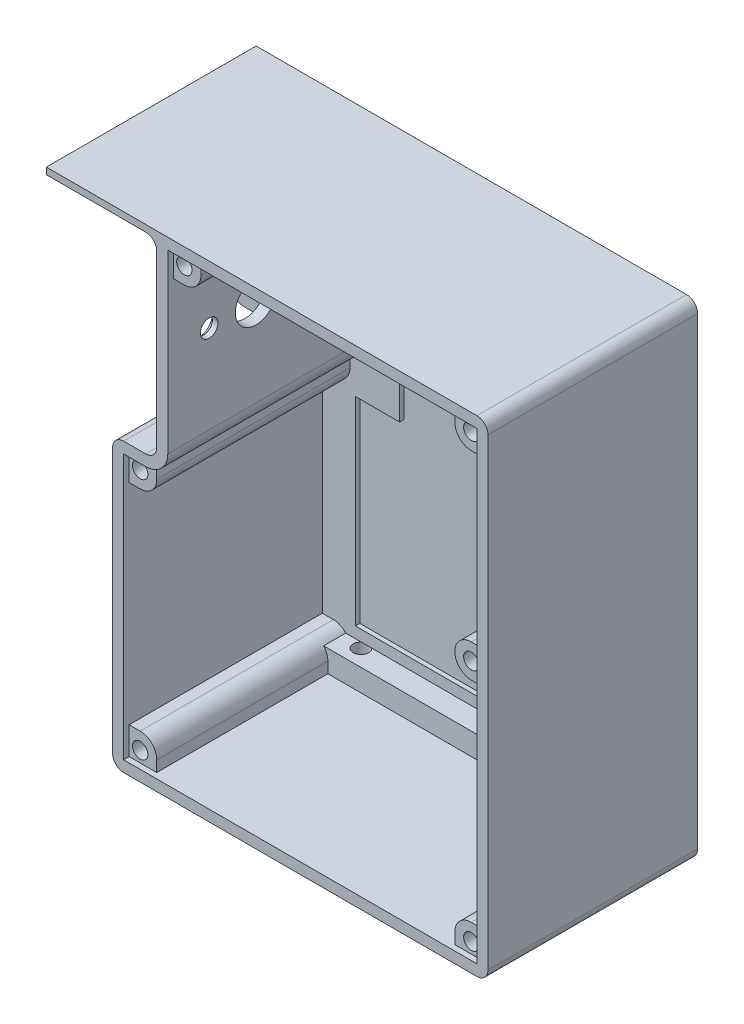
from build123d import *

# Parameters (mm, degrees)
EXTRUDE_1_DEPTH     = 38
SHELL_1_T           = -2
SKETCH_9_W          = 20
SKETCH_9_H          = 34.8
EXTRUDE_3_DEPTH     = 6
SKETCH_9_3_W        = 20
SKETCH_9_3_H        = 1.2
EXTRUDE_4_DEPTH     = 38
FILLET_1_R          = 2
FILLET_2_R          = 4
FILLET_4_R          = 2
SKETCH_3_W          = 6
SKETCH_3_H          = 6
SKETCH_3_R          = 1.4
EXTRUDE_2_DEPTH     = 35
FILLET_3_R          = 3
SKETCH_2_R          = 3.75
SKETCH_2_R_2        = 1.6
CUT_EXTRUDE_1_DEPTH = 30
CHAMFER_1_SIZE      = 1
CUT_EXTRUDE_START   = -2
SKETCH_2_3_R        = 12.5
CUT_EXTRUDE_2_DEPTH = 5
CUT_EXTRUDE_START_2 = 1.2
CUT_EXTRUDE_4_DEPTH = 10
SKETCH_10_R         = 1.4
CUT_EXTRUDE_5_DEPTH = 8
SKETCH_11_W         = 56
SKETCH_11_H         = 6
SKETCH_11_R         = 1.4
EXTRUDE_5_DEPTH     = 6
SKETCH_11_2_R       = 1.4
CUT_EXTRUDE_6_DEPTH = 6


with BuildPart() as part:
    # 草图1 → 凸台-拉伸1 (new body)
    with BuildSketch(Plane.XY):
        Polygon((0, 0), (68, 0), (68, 88), (8, 88), (8, 52), (0, 52), align=None)
    extrude(amount=EXTRUDE_1_DEPTH)

    # 抽壳1
    shell_1_openings = [part.faces().sort_by_distance(p)[0] for p in [
        (35.516853933, 42.685393258, 38),
    ]]
    offset(amount=SHELL_1_T, openings=shell_1_openings, kind=Kind.INTERSECTION)

    # 草图9 → 凸台-拉伸3 (add)
    with BuildSketch(Plane.XY):
        with Locations((-2, 69.4)):
            Rectangle(SKETCH_9_W, SKETCH_9_H)
    extrude(amount=EXTRUDE_3_DEPTH)

    # 草图9<3> → 凸台-拉伸4 (add)
    with BuildSketch(Plane.XY):
        with Locations((-2, 87.4)):
            Rectangle(SKETCH_9_3_W, SKETCH_9_3_H)
    extrude(amount=EXTRUDE_4_DEPTH)

    # 圆角1
    fillet_1_edges = [part.edges().sort_by_distance(p)[0] for p in [
        (0, 0, 19),
        (8, 52, 22),
        (68, 88, 19),
        (68, 0, 19),
        (0, 52, 3),
        (8, 86.8, 22),
    ]]
    fillet(fillet_1_edges, radius=FILLET_1_R)

    # 圆角2
    fillet_2_edges = [part.edges().sort_by_distance(p)[0] for p in [
        (10, 50, 20),
        (-12, 52, 3),
    ]]
    fillet(fillet_2_edges, radius=FILLET_2_R)

    # 圆角4
    fillet_4_edges = [part.edges().sort_by_distance(p)[0] for p in [
        (0, 52, 22),
    ]]
    fillet(fillet_4_edges, radius=FILLET_4_R)

    # 草图3 → 凸台-拉伸2 (add)
    # profile 1 of 6: a face of its own
    with BuildSketch(Plane.XY.offset(2)):
        with Locations((64, 84)):
            Rectangle(SKETCH_3_W, SKETCH_3_H)
        with Locations((64, 84)):
            Circle(SKETCH_3_R, mode=Mode.SUBTRACT)
    # profile 2 of 6: a face of its own
    with BuildSketch(Plane.XY.offset(2)):
        with Locations((12, 84)):
            Rectangle(SKETCH_3_W, SKETCH_3_H)
        with Locations((12, 84)):
            Circle(SKETCH_3_R, mode=Mode.SUBTRACT)
    # profile 3 of 6: a face of its own
    with BuildSketch(Plane.XY.offset(2)):
        with Locations((64, 4)):
            Rectangle(SKETCH_3_W, SKETCH_3_H)
        with Locations((64, 4)):
            Circle(SKETCH_3_R, mode=Mode.SUBTRACT)
    # profile 4 of 6: a face of its own
    with BuildSketch(Plane.XY.offset(2)):
        with Locations((4, 48)):
            Rectangle(SKETCH_3_W, SKETCH_3_H)
        with Locations((4, 48)):
            Circle(SKETCH_3_R, mode=Mode.SUBTRACT)
    # profile 5 of 6: a face of its own
    with BuildSketch(Plane.XY.offset(2)):
        with Locations((4, 4)):
            Rectangle(SKETCH_3_W, SKETCH_3_H)
        with Locations((4, 4)):
            Circle(SKETCH_3_R, mode=Mode.SUBTRACT)
    # profile 6 of 6: a face of its own
    with BuildSketch(Plane.XY.offset(2)):
        with Locations((64, 48)):
            Rectangle(SKETCH_3_W, SKETCH_3_H)
        with Locations((64, 48)):
            Circle(SKETCH_3_R, mode=Mode.SUBTRACT)
    extrude(amount=EXTRUDE_2_DEPTH)

    # 圆角3
    fillet_3_edges = [part.edges().sort_by_distance(p)[0] for p in [
        (15, 81, 19.5),
        (61, 81, 19.5),
        (61, 7, 19.5),
        (7, 45, 19.5),
        (7, 7, 19.5),
        (61, 45, 19.5),
        (61, 51, 19.5),
    ]]
    fillet(fillet_3_edges, radius=FILLET_3_R - 0.0001)  # a hair under: the kernel refuses the full size

    # 草图2 → 切除-拉伸1 (cut)
    with BuildSketch(Plane.ZY.offset(-8)):
        with Locations(Location((22, 70, 0), (0, 0, 270))):
            Circle(SKETCH_2_R)
        with Locations(Location((30.5, 70, 0), (0, 0, 270))):
            Circle(SKETCH_2_R_2)
        with Locations(Location((13.5, 70, 0), (0, 0, 270))):
            Circle(SKETCH_2_R_2)
    extrude(amount=-CUT_EXTRUDE_1_DEPTH, mode=Mode.SUBTRACT)

    # 倒角1
    chamfer_1_edges = [part.edges().sort_by_distance(p)[0] for p in [
        (8, 71.6, 13.5),
        (8, 71.6, 30.5),
    ]]
    chamfer(chamfer_1_edges, length=CHAMFER_1_SIZE)

    # 草图2<3> → 切除-拉伸2 (cut)
    with BuildSketch(Plane.ZY.offset(-8).offset(CUT_EXTRUDE_START)):
        with Locations((22, 70)):
            Circle(SKETCH_2_3_R)
    extrude(amount=-CUT_EXTRUDE_2_DEPTH, mode=Mode.SUBTRACT)

    # 草图1<3> → 切除-拉伸4 (cut)
    with BuildSketch(Plane.XY.offset(CUT_EXTRUDE_START_2)):
        Polygon((8, 44), (8, 8), (60, 8), (60, 80), (16, 80), (16, 44), align=None)
    extrude(amount=CUT_EXTRUDE_4_DEPTH, mode=Mode.SUBTRACT)

    # 草图10 → 切除-拉伸5 (cut)
    with BuildSketch(Plane.ZY.offset(12)):
        with Locations(Location((3, 82, 0), (0, 0, 270))):
            Circle(SKETCH_10_R)
        with Locations(Location((3, 62, 0), (0, 0, 270))):
            Circle(SKETCH_10_R)
    extrude(amount=-CUT_EXTRUDE_5_DEPTH, mode=Mode.SUBTRACT)

    # 草图11 → 凸台-拉伸5 (add)
    with BuildSketch(Plane.XZ):
        with Locations((34, 3)):
            Rectangle(SKETCH_11_W, SKETCH_11_H)
        with Locations((10, 3)):
            Circle(SKETCH_11_R, mode=Mode.SUBTRACT)
        with Locations((34, 3)):
            Circle(SKETCH_11_R, mode=Mode.SUBTRACT)
        with Locations((58, 3)):
            Circle(SKETCH_11_R, mode=Mode.SUBTRACT)
    extrude(amount=-EXTRUDE_5_DEPTH)

    # 草图11<2> → 切除-拉伸6 (cut)
    with BuildSketch(Plane.XZ):
        with Locations(Location((10, 3, 0), (0, 0, 270))):
            Circle(SKETCH_11_2_R)
        with Locations(Location((58, 3, 0), (0, 0, 270))):
            Circle(SKETCH_11_2_R)
        with Locations(Location((34, 3, 0), (0, 0, 270))):
            Circle(SKETCH_11_2_R)
    extrude(amount=-CUT_EXTRUDE_6_DEPTH, mode=Mode.SUBTRACT)


solid = part.part
